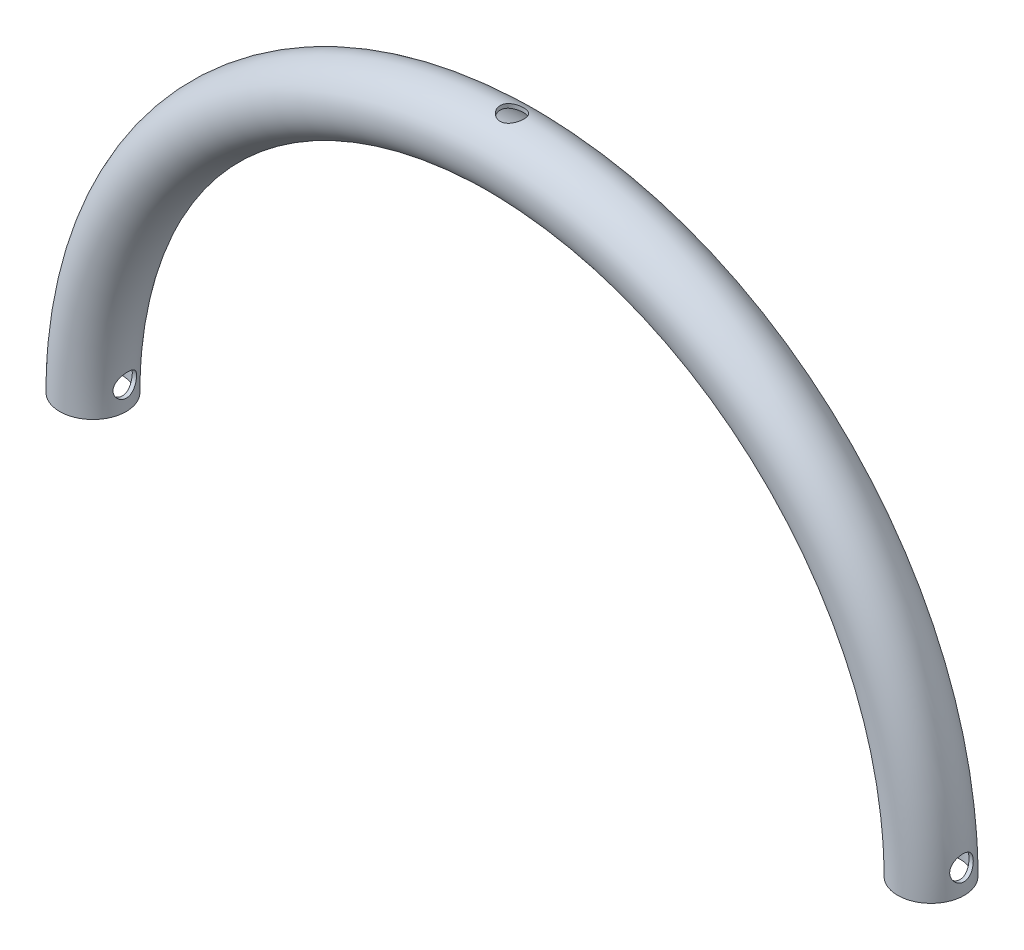
from build123d import *

# Parameters (mm, degrees)
SKETCH1_R               = 8.9662
SKETCH1_R_2             = 7.8994
CUT_EXTRUDE1_DEPTH      = 265.954298543
CUT_EXTRUDE1_DEPTH_BACK = 265.954298543
SKETCH3_R               = 3.175
CUT_EXTRUDE4_DEPTH      = 265.954298543
CUT_EXTRUDE4_DEPTH_BACK = 2.54
SKETCH6_R               = 3.175


with BuildPart() as part:
    # Sweep1: sweep along a path in Sketch2
    with BuildLine(Plane.XY) as sweep1_path:
        ThreePointArc((0, 0), (113.03, 113.03), (226.06, 0))
    # Sketch1 → Sweep1 (sweep)
    with BuildSketch(Plane(origin=(0, 0, 0), x_dir=(1, 0, 0), z_dir=(0, 1, 0))):
        Circle(SKETCH1_R)
        Circle(SKETCH1_R_2, mode=Mode.SUBTRACT)
    sweep(path=sweep1_path.line)

    # Sketch3 → Cut-Extrude1 (cut, two sides: drawn at the far end of the back side and taken through both)
    with BuildSketch(Plane(origin=(0, 0, 0), x_dir=(0, 0, -1), z_dir=(1, 0, 0)).offset(-CUT_EXTRUDE1_DEPTH_BACK)):
        with Locations((0, 6.35)):
            Circle(SKETCH3_R)
    extrude(amount=CUT_EXTRUDE1_DEPTH + CUT_EXTRUDE1_DEPTH_BACK, mode=Mode.SUBTRACT)

    # Sketch6 → Cut-Extrude4 (cut, two sides: drawn at the far end of the back side and taken through both)
    with BuildSketch(Plane(origin=(0, 0, 0), x_dir=(1, 0, 0), z_dir=(0, 1, 0)).offset(-CUT_EXTRUDE4_DEPTH_BACK)):
        with Locations((113.03, 0)):
            Circle(SKETCH6_R)
    extrude(amount=CUT_EXTRUDE4_DEPTH + CUT_EXTRUDE4_DEPTH_BACK, mode=Mode.SUBTRACT)


solid = part.part
